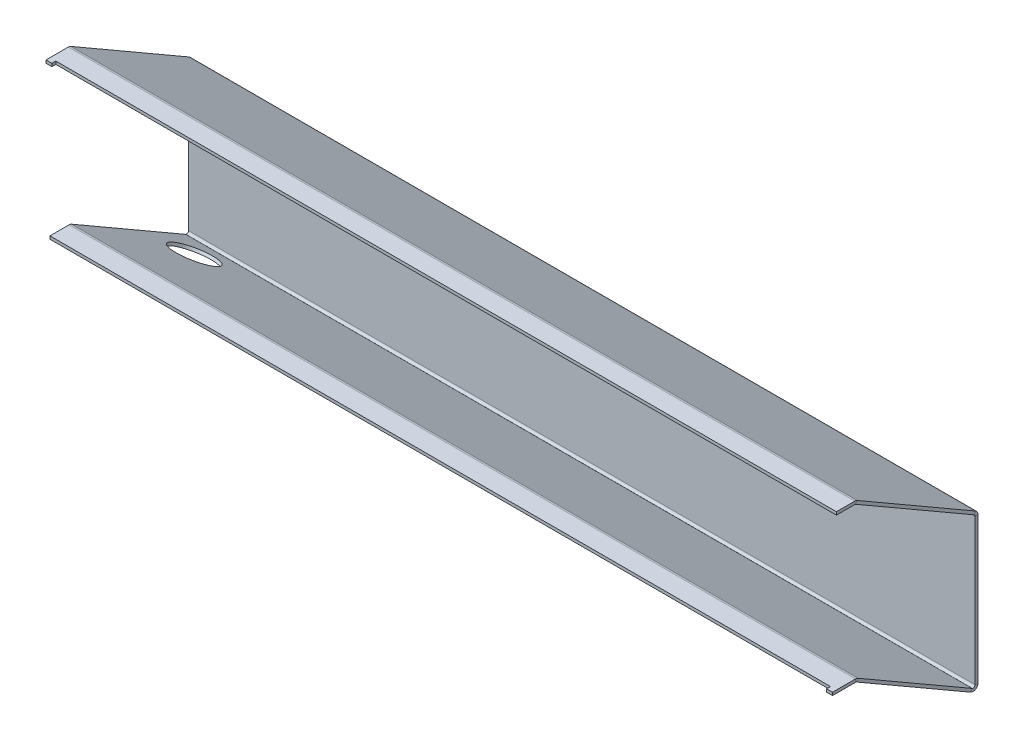
from build123d import *

# Parameters (mm, degrees)
SM_BASE_FLANGE_1_DEPTH = 400
SKETCH_7_W             = 3
SKETCH_7_H             = 1.5
EXTRUDE_1_DEPTH        = 2
SKETCH_9_R             = 10.75
CUT_EXTRUDE_2_DEPTH    = 10


# Sheet-metal steps are written as plain solids
with BuildPart() as part:
    # Sketch 1 → Базовая кромка1 (new body)
    with BuildSketch(Plane(origin=(0, 0, 0), x_dir=(0, 0, -1), z_dir=(1, 0, 0))):
        with BuildLine():
            Line((-22.356799498, 0), (-12.62474869, 0))
            ThreePointArc((-12.62474869, 0), (-12.365929645, -0.034074174), (-12.12474869, -0.133974596))
            Line((-12.12474869, -0.133974596), (45.893200502, -33.63065318))
            ThreePointArc((45.893200502, -33.63065318), (48.393200502, -33.63065318), (49.643200502, -31.465589671))
            Line((49.643200502, -31.465589671), (49.643200502, 42.760907637))
            ThreePointArc((49.643200502, 42.760907637), (49.308264012, 44.010907637), (48.393200502, 44.925971147))
            Line((48.393200502, 44.925971147), (-11.776672479, 79.665063509))
            ThreePointArc((-11.776672479, 79.665063509), (-12.379624866, 79.914814566), (-13.026672479, 80))
            Line((-13.026672479, 80), (-22.356799498, 80))
            Line((-22.356799498, 80), (-22.356799498, 78.5))
            Line((-22.356799498, 78.5), (-13.026672479, 78.5))
            ThreePointArc((-13.026672479, 78.5), (-12.767853434, 78.465925826), (-12.526672479, 78.366025404))
            Line((-12.526672479, 78.366025404), (47.643200502, 43.626933041))
            ThreePointArc((47.643200502, 43.626933041), (48.009225906, 43.260907637), (48.143200502, 42.760907637))
            Line((48.143200502, 42.760907637), (48.143200502, -31.465589671))
            ThreePointArc((48.143200502, -31.465589671), (47.643200502, -32.331615075), (46.643200502, -32.331615075))
            Line((46.643200502, -32.331615075), (-11.37474869, 1.165063509))
            ThreePointArc((-11.37474869, 1.165063509), (-11.977701077, 1.414814566), (-12.62474869, 1.5))
            Line((-12.62474869, 1.5), (-22.356799498, 1.5))
            Line((-22.356799498, 1.5), (-22.356799498, 0))
        make_face()
    extrude(amount=-SM_BASE_FLANGE_1_DEPTH)

    # Эскиз7 → Бобышка-Вытянуть1 (add)
    with BuildSketch(Plane.XY.offset(22.356799498)):
        with Locations((-398.5, 79.25)):
            Rectangle(SKETCH_7_W, SKETCH_7_H)
        with Locations((-1.5, 0.75)):
            Rectangle(SKETCH_7_W, SKETCH_7_H)
    extrude(amount=EXTRUDE_1_DEPTH)

    # Эскиз9 → Вырез-Вытянуть2 (cut)
    with BuildSketch(Plane(origin=(0, -5.350651137, 3.089199874), x_dir=(1, 0, 0), z_dir=(0, -0.86602540378444, 0.49999999999999756))):
        with Locations(Location((-380, -38.560004086, 0), (0, 0, 270))):
            Circle(SKETCH_9_R)
    extrude(amount=-CUT_EXTRUDE_2_DEPTH, mode=Mode.SUBTRACT)


solid = part.part
